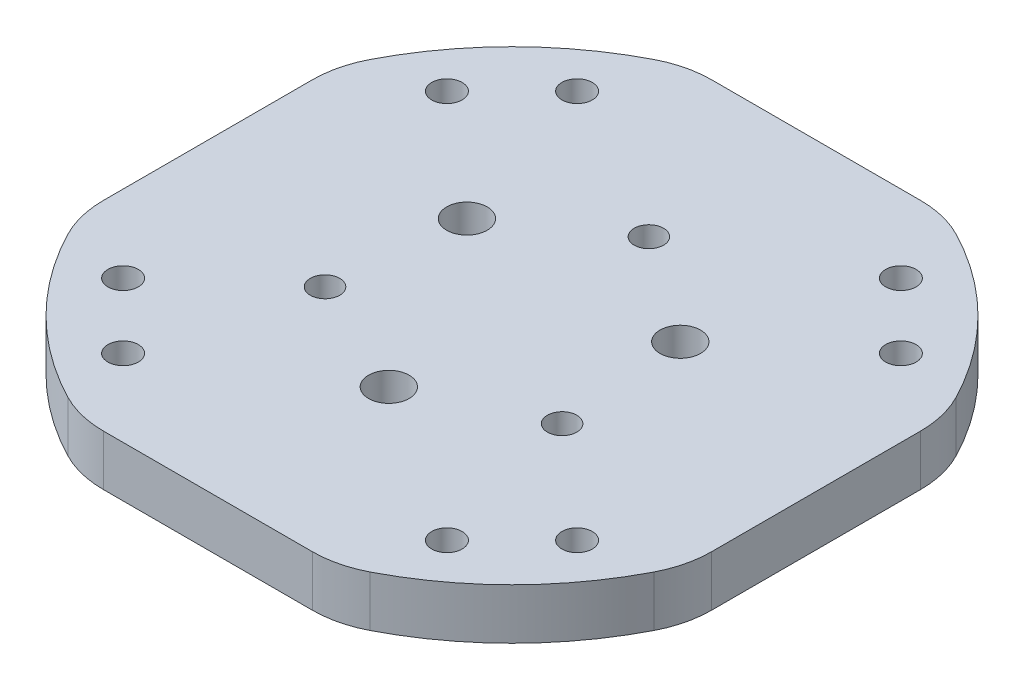
from build123d import *

# Parameters (mm, degrees)
SKETCH_1_R          = 19
SKETCH_1_R_2        = 1.45
SKETCH_1_R_3        = 2
EXTRUDE_1_DEPTH     = 12
EXTRUDE_START       = -7
SKETCH_2_R          = 1.45
SKETCH_2_R_2        = 2
EXTRUDE_2_DEPTH     = 7
SKETCH_3_R          = 1.45
CUT_EXTRUDE_1_DEPTH = 8
SKETCH_4_R          = 1.45
CUT_EXTRUDE_2_DEPTH = 8
SKETCH_5_R          = 1.45
CUT_EXTRUDE_3_DEPTH = 8
CUT_EXTRUDE_START   = -8
SKETCH_6_R          = 1.45
CUT_EXTRUDE_4_DEPTH = 8
SKETCH_7_R          = 1.45
CUT_EXTRUDE_5_DEPTH = 8
EXTRUDE_START_2     = -5
SKETCH_8_R          = 1.5
SKETCH_8_R_2        = 2
EXTRUDE_3_DEPTH     = 5
FILLET_1_R          = 3
CHAMFER_1_SIZE      = 1.55


with BuildPart() as part:
    # 草图1 → 凸台-拉伸1 (new body)
    with BuildSketch(Plane(origin=(0, 0, 0), x_dir=(1, 0, 0), z_dir=(0, 1, 0))):
        with Locations(Location((0, 0, 0), (0, 0, 270))):
            Circle(SKETCH_1_R)
        with Locations(Location((0, 13.5, 0), (0, 0, 270))):
            Circle(SKETCH_1_R_2, mode=Mode.SUBTRACT)
        with Locations(Location((-11.691342951, -6.75, 0), (0, 0, 270))):
            Circle(SKETCH_1_R_2, mode=Mode.SUBTRACT)
        with Locations(Location((11.691342951, -6.75, 0), (0, 0, 270))):
            Circle(SKETCH_1_R_2, mode=Mode.SUBTRACT)
        with Locations(Location((-10.522208656, 6.075, 0), (0, 0, 270))):
            Circle(SKETCH_1_R_3, mode=Mode.SUBTRACT)
        with Locations(Location((0, -12.15, 0), (0, 0, 270))):
            Circle(SKETCH_1_R_3, mode=Mode.SUBTRACT)
        with Locations(Location((10.522208656, 6.075, 0), (0, 0, 270))):
            Circle(SKETCH_1_R_3, mode=Mode.SUBTRACT)
    extrude(amount=EXTRUDE_1_DEPTH)

    # 草图2 → 凸台-拉伸2 (add)
    with BuildSketch(Plane(origin=(0, 12, 0), x_dir=(1, 0, 0), z_dir=(0, 1, 0)).offset(EXTRUDE_START)):
        Polygon((0, 21.939310229), (-19, 10.969655115), (-19, -10.969655115), (0, -21.939310229), (19, -10.969655115), (19, 10.969655115), align=None)
        with Locations(Location((0, 13.5, 0), (0, 0, 270))):
            Circle(SKETCH_2_R, mode=Mode.SUBTRACT)
        with Locations(Location((-10.522208656, 6.075, 0), (0, 0, 270))):
            Circle(SKETCH_2_R_2, mode=Mode.SUBTRACT)
        with Locations(Location((10.522208656, 6.075, 0), (0, 0, 270))):
            Circle(SKETCH_2_R_2, mode=Mode.SUBTRACT)
        with Locations(Location((-11.691342951, -6.75, 0), (0, 0, 270))):
            Circle(SKETCH_2_R, mode=Mode.SUBTRACT)
        with Locations(Location((0, -12.15, 0), (0, 0, 270))):
            Circle(SKETCH_2_R_2, mode=Mode.SUBTRACT)
        with Locations(Location((11.691342951, -6.75, 0), (0, 0, 270))):
            Circle(SKETCH_2_R, mode=Mode.SUBTRACT)
    extrude(amount=EXTRUDE_2_DEPTH)

    # 草图3 → 切除-拉伸1 (cut)
    with BuildSketch(Plane(origin=(9.5, 0, 16.454482672), x_dir=(0.8660254037844384, 0, -0.5000000000000004), z_dir=(0.5000000000000004, 0, 0.8660254037844384))):
        with Locations((0, 8.5)):
            Circle(SKETCH_3_R)
    extrude(amount=-CUT_EXTRUDE_1_DEPTH, mode=Mode.SUBTRACT)

    # 草图4 → 切除-拉伸2 (cut)
    with BuildSketch(Plane(origin=(-9.5, 0, 16.454482672), x_dir=(0.8660254037844385, 0, 0.5000000000000004), z_dir=(-0.5000000000000003, 0, 0.8660254037844384))):
        with Locations((0, 8.5)):
            Circle(SKETCH_4_R)
    extrude(amount=-CUT_EXTRUDE_2_DEPTH, mode=Mode.SUBTRACT)

    # 草图5 → 切除-拉伸3 (cut)
    with BuildSketch(Plane.ZY.offset(19)):
        with Locations((0, 8.5)):
            Circle(SKETCH_5_R)
    extrude(amount=-CUT_EXTRUDE_3_DEPTH, mode=Mode.SUBTRACT)

    # 草图6 → 切除-拉伸4 (cut)
    with BuildSketch(Plane(origin=(19, 0, 0), x_dir=(0, 0, -1), z_dir=(1, 0, 0)).offset(CUT_EXTRUDE_START)):
        with Locations(Location((0, 8.5, 0), (0, 0, 180))):
            Circle(SKETCH_6_R)
    extrude(amount=CUT_EXTRUDE_4_DEPTH, mode=Mode.SUBTRACT)

    # 草图7 → 切除-拉伸5 (cut)
    with BuildSketch(Plane(origin=(9.5, 0, -16.454482672), x_dir=(-0.8660254037844387, 0, -0.49999999999999994), z_dir=(0.4999999999999999, 0, -0.8660254037844386)).offset(CUT_EXTRUDE_START)):
        with Locations(Location((0, 8.5, 0), (0, 0, 180))):
            Circle(SKETCH_7_R)
    extrude(amount=CUT_EXTRUDE_5_DEPTH, mode=Mode.SUBTRACT)

    # 草图8 → 凸台-拉伸3 (add)
    with BuildSketch(Plane(origin=(0, 12, 0), x_dir=(1, 0, 0), z_dir=(0, 1, 0)).offset(EXTRUDE_START_2)):
        with BuildLine():
            Line((10.307764064, 30), (-10.307764064, 30))
            ThreePointArc((-10.307764064, 30), (-12.664786668, 29.718253158), (-14.888992537, 28.888888889))
            ThreePointArc((-14.888992537, 28.888888889), (-22.980970389, 22.980970389), (-28.888888889, 14.888992537))
            ThreePointArc((-28.888888889, 14.888992537), (-29.718253158, 12.664786668), (-30, 10.307764064))
            Line((-30, 10.307764064), (-30, -10.307764064))
            ThreePointArc((-30, -10.307764064), (-29.718253158, -12.664786668), (-28.888888889, -14.888992537))
            ThreePointArc((-28.888888889, -14.888992537), (-22.980970389, -22.980970389), (-14.888992537, -28.888888889))
            ThreePointArc((-14.888992537, -28.888888889), (-12.664786668, -29.718253158), (-10.307764064, -30))
            Line((-10.307764064, -30), (10.307764064, -30))
            ThreePointArc((10.307764064, -30), (12.664786668, -29.718253158), (14.888992537, -28.888888889))
            ThreePointArc((14.888992537, -28.888888889), (22.980970389, -22.980970389), (28.888888889, -14.888992537))
            ThreePointArc((28.888888889, -14.888992537), (29.718253158, -12.664786668), (30, -10.307764064))
            Line((30, -10.307764064), (30, 10.307764064))
            ThreePointArc((30, 10.307764064), (29.718253158, 12.664786668), (28.888888889, 14.888992537))
            ThreePointArc((28.888888889, 14.888992537), (22.980970389, 22.980970389), (14.888992537, 28.888888889))
            ThreePointArc((14.888992537, 28.888888889), (12.664786668, 29.718253158), (10.307764064, 30))
        make_face()
        with Locations(Location((-22.388176755, 15.969331282, 0), (0, 0, 270))):
            Circle(SKETCH_8_R, mode=Mode.SUBTRACT)
        with Locations(Location((-15.969331282, 22.388176755, 0), (0, 0, 270))):
            Circle(SKETCH_8_R, mode=Mode.SUBTRACT)
        with Locations(Location((-22.388176755, -15.969331282, 0), (0, 0, 90))):
            Circle(SKETCH_8_R, mode=Mode.SUBTRACT)
        with Locations(Location((-15.969331282, -22.388176755, 0), (0, 0, 90))):
            Circle(SKETCH_8_R, mode=Mode.SUBTRACT)
        with Locations(Location((15.969331282, -22.388176755, 0), (0, 0, 270))):
            Circle(SKETCH_8_R, mode=Mode.SUBTRACT)
        with Locations(Location((22.388176755, -15.969331282, 0), (0, 0, 270))):
            Circle(SKETCH_8_R, mode=Mode.SUBTRACT)
        with Locations(Location((22.388176755, 15.969331282, 0), (0, 0, 90))):
            Circle(SKETCH_8_R, mode=Mode.SUBTRACT)
        with Locations(Location((15.969331282, 22.388176755, 0), (0, 0, 90))):
            Circle(SKETCH_8_R, mode=Mode.SUBTRACT)
        with Locations((0, 13.5)):
            Circle(SKETCH_8_R, mode=Mode.SUBTRACT)
        with Locations((11.691342951, -6.75)):
            Circle(SKETCH_8_R, mode=Mode.SUBTRACT)
        with Locations(Location((0, -12.15, 0), (0, 0, 270))):
            Circle(SKETCH_8_R_2, mode=Mode.SUBTRACT)
        with Locations(Location((10.522208656, 6.075, 0), (0, 0, 270))):
            Circle(SKETCH_8_R_2, mode=Mode.SUBTRACT)
        with Locations((-11.691342951, -6.75)):
            Circle(SKETCH_8_R, mode=Mode.SUBTRACT)
        with Locations(Location((-10.522208656, 6.075, 0), (0, 0, 270))):
            Circle(SKETCH_8_R_2, mode=Mode.SUBTRACT)
    extrude(amount=EXTRUDE_3_DEPTH)

    # 圆角1
    # the kernel refuses this fillet: 3 mm, written as the material it adds along each edge
    with BuildSketch(Plane(origin=(-25.123724357, 7, 7.434121209), x_dir=(0, -1, 0), z_dir=(0.8660254037844385, 0, 0.5000000000000003))) as fillet_1_piece_1_section:
        with BuildLine():
            CenterArc((3, -2.828427125), FILLET_1_R, 109.471220634, 70.528779366)
            Line((0, -2.828427125), (-0.06, -2.828427125))
            Line((-0.06, -2.828427125), (-0.06, 0))
            Line((-0.06, 0), (0, 0.06))
            ThreePointArc((0, 0.06), (1, 0.06), (1.98, 0.056568542))
            Line((1.98, 0.056568542), (2, 0))
        make_face()
    fillet_1_piece_1 = extrude(amount=36.081445853, mode=Mode.PRIVATE)
    fillet_1_piece_1 = split(fillet_1_piece_1, bisect_by=Plane(origin=(-5.242974287, 6.477045854, 24.966342845), z_dir=(-0.5000000000000004, 0, -0.8660254037844384)), keep=Keep.TOP, mode=Mode.PRIVATE)
    fillet_1_piece_1 = split(fillet_1_piece_1, bisect_by=Plane(origin=(-19, 6.477045854, 17.023720346), z_dir=(1, 0, 0)), keep=Keep.TOP, mode=Mode.PRIVATE)
    add(fillet_1_piece_1)
    with BuildSketch(Plane(origin=(-6.123724357, 7, 25.474844135), x_dir=(0, -1, 0), z_dir=(0.8660254037844384, 0, -0.5000000000000004))) as fillet_1_piece_2_section:
        with BuildLine():
            CenterArc((3, -2.828427125), FILLET_1_R, 109.471220634, 70.528779366)
            Line((0, -2.828427125), (-0.06, -2.828427125))
            Line((-0.06, -2.828427125), (-0.06, 0))
            Line((-0.06, 0), (0, 0.06))
            ThreePointArc((0, 0.06), (1, 0.06), (1.98, 0.056568542))
            Line((1.98, 0.056568542), (2, 0))
        make_face()
    fillet_1_piece_2 = extrude(amount=36.081445853, mode=Mode.PRIVATE)
    fillet_1_piece_2 = split(fillet_1_piece_2, bisect_by=Plane(origin=(19, 6.477045854, 17.023720346), z_dir=(-1, 0, 0)), keep=Keep.TOP, mode=Mode.PRIVATE)
    fillet_1_piece_2 = split(fillet_1_piece_2, bisect_by=Plane(origin=(5.242974287, 6.477045854, 24.966342845), z_dir=(0.5000000000000003, 0, -0.8660254037844385)), keep=Keep.TOP, mode=Mode.PRIVATE)
    add(fillet_1_piece_2)
    with BuildSketch(Plane(origin=(19, 7, 18.040722926), x_dir=(1, 0, 0), z_dir=(0, 0, -1))) as fillet_1_piece_3_section:
        with BuildLine():
            CenterArc((2.828427125, 3), FILLET_1_R, 199.471220634, 70.528779366)
            Line((0, 2), (-0.056568542, 1.98))
            ThreePointArc((-0.056568542, 1.98), (-0.06, 1), (-0.06, 0))
            Line((-0.06, 0), (0, -0.06))
            Line((0, -0.06), (2.828427125, -0.06))
            Line((2.828427125, -0.06), (2.828427125, 0))
        make_face()
    fillet_1_piece_3 = extrude(amount=36.081445853, mode=Mode.PRIVATE)
    fillet_1_piece_3 = split(fillet_1_piece_3, bisect_by=Plane(origin=(24.242974287, 6.477045854, 7.942622499), z_dir=(-0.5000000000000004, 0, -0.8660254037844384)), keep=Keep.TOP, mode=Mode.PRIVATE)
    fillet_1_piece_3 = split(fillet_1_piece_3, bisect_by=Plane(origin=(24.242974287, 6.477045854, -7.942622499), z_dir=(-0.49999999999999983, 0, 0.8660254037844388)), keep=Keep.TOP, mode=Mode.PRIVATE)
    add(fillet_1_piece_3)
    with BuildSketch(Plane(origin=(25.123724357, 7, -7.434121209), x_dir=(0, -1, 0), z_dir=(-0.8660254037844388, 0, -0.49999999999999983))) as fillet_1_piece_4_section:
        with BuildLine():
            CenterArc((3, -2.828427125), FILLET_1_R, 109.471220634, 70.528779366)
            Line((0, -2.828427125), (-0.06, -2.828427125))
            Line((-0.06, -2.828427125), (-0.06, 0))
            Line((-0.06, 0), (0, 0.06))
            ThreePointArc((0, 0.06), (1, 0.06), (1.98, 0.056568542))
            Line((1.98, 0.056568542), (2, 0))
        make_face()
    fillet_1_piece_4 = extrude(amount=36.081445853, mode=Mode.PRIVATE)
    fillet_1_piece_4 = split(fillet_1_piece_4, bisect_by=Plane(origin=(5.242974287, 6.477045854, -24.966342845), z_dir=(0.5000000000000001, 0, 0.8660254037844386)), keep=Keep.TOP, mode=Mode.PRIVATE)
    fillet_1_piece_4 = split(fillet_1_piece_4, bisect_by=Plane(origin=(19, 6.477045854, -17.023720346), z_dir=(-1, 0, 0)), keep=Keep.TOP, mode=Mode.PRIVATE)
    add(fillet_1_piece_4)
    with BuildSketch(Plane(origin=(6.123724357, 7, -25.474844135), x_dir=(0, -1, 0), z_dir=(-0.8660254037844386, 0, 0.5000000000000001))) as fillet_1_piece_5_section:
        with BuildLine():
            CenterArc((3, -2.828427125), FILLET_1_R, 109.471220634, 70.528779366)
            Line((0, -2.828427125), (-0.06, -2.828427125))
            Line((-0.06, -2.828427125), (-0.06, 0))
            Line((-0.06, 0), (0, 0.06))
            ThreePointArc((0, 0.06), (1, 0.06), (1.98, 0.056568542))
            Line((1.98, 0.056568542), (2, 0))
        make_face()
    fillet_1_piece_5 = extrude(amount=36.081445853, mode=Mode.PRIVATE)
    fillet_1_piece_5 = split(fillet_1_piece_5, bisect_by=Plane(origin=(-19, 6.477045854, -17.023720346), z_dir=(1, 0, 0)), keep=Keep.TOP, mode=Mode.PRIVATE)
    fillet_1_piece_5 = split(fillet_1_piece_5, bisect_by=Plane(origin=(-5.242974287, 6.477045854, -24.966342845), z_dir=(-0.49999999999999983, 0, 0.8660254037844388)), keep=Keep.TOP, mode=Mode.PRIVATE)
    add(fillet_1_piece_5)
    with BuildSketch(Plane(origin=(-19, 7, -18.040722926), x_dir=(0, -1, 0), z_dir=(0, 0, 1))) as fillet_1_piece_6_section:
        with BuildLine():
            CenterArc((3, -2.828427125), FILLET_1_R, 109.471220634, 70.528779366)
            Line((0, -2.828427125), (-0.06, -2.828427125))
            Line((-0.06, -2.828427125), (-0.06, 0))
            Line((-0.06, 0), (0, 0.06))
            ThreePointArc((0, 0.06), (1, 0.06), (1.98, 0.056568542))
            Line((1.98, 0.056568542), (2, 0))
        make_face()
    fillet_1_piece_6 = extrude(amount=36.081445853, mode=Mode.PRIVATE)
    fillet_1_piece_6 = split(fillet_1_piece_6, bisect_by=Plane(origin=(-24.242974287, 6.477045854, 7.942622499), z_dir=(0.5000000000000003, 0, -0.8660254037844385)), keep=Keep.TOP, mode=Mode.PRIVATE)
    fillet_1_piece_6 = split(fillet_1_piece_6, bisect_by=Plane(origin=(-24.242974287, 6.477045854, -7.942622499), z_dir=(0.5000000000000001, 0, 0.8660254037844386)), keep=Keep.TOP, mode=Mode.PRIVATE)
    add(fillet_1_piece_6)
    with BuildSketch(Plane(origin=(-25.123724357, 7, 7.434121209), x_dir=(0, -1, 0), z_dir=(0.8660254037844385, 0, 0.5000000000000003))) as fillet_1_piece_7a_section:
        with BuildLine():
            CenterArc((3, -2.828427125), FILLET_1_R, 109.471220634, 70.528779366)
            Line((0, -2.828427125), (-0.06, -2.828427125))
            Line((-0.06, -2.828427125), (-0.06, 0))
            Line((-0.06, 0), (0, 0.06))
            ThreePointArc((0, 0.06), (1, 0.06), (1.98, 0.056568542))
            Line((1.98, 0.056568542), (2, 0))
        make_face()
    fillet_1_piece_7a = extrude(amount=36.081445853, mode=Mode.PRIVATE)
    fillet_1_piece_7a = split(fillet_1_piece_7a, bisect_by=Plane(origin=(-19, 6.499823967, 9.91733875), z_dir=(-1, 0, 0)), keep=Keep.TOP, mode=Mode.PRIVATE)
    with BuildSketch(Plane(origin=(-19, 7, -18.040722926), x_dir=(0, -1, 0), z_dir=(0, 0, 1))) as fillet_1_piece_7b_section:
        with BuildLine():
            CenterArc((3, -2.828427125), FILLET_1_R, 109.471220634, 70.528779366)
            Line((0, -2.828427125), (-0.06, -2.828427125))
            Line((-0.06, -2.828427125), (-0.06, 0))
            Line((-0.06, 0), (0, 0.06))
            ThreePointArc((0, 0.06), (1, 0.06), (1.98, 0.056568542))
            Line((1.98, 0.056568542), (2, 0))
        make_face()
    fillet_1_piece_7b = extrude(amount=36.081445853, mode=Mode.PRIVATE)
    fillet_1_piece_7b = split(fillet_1_piece_7b, bisect_by=Plane(origin=(-18.0817985, 6.492985076, 11.499778998), z_dir=(-0.5000000000000003, 0, 0.8660254037844385)), keep=Keep.TOP, mode=Mode.PRIVATE)
    fillet_1_piece_7b = fillet_1_piece_7b - Plane(origin=(-22.388176755, 6.492985076, 15.969331282), x_dir=(0, 0, -1), z_dir=(0, -1, 0)) * Cylinder(1.5, 84, mode=Mode.PRIVATE)
    fillet_1_piece_7 = fillet_1_piece_7a & fillet_1_piece_7b
    add(fillet_1_piece_7)
    with BuildSketch(Plane(origin=(-6.123724357, 7, 25.474844135), x_dir=(0, -1, 0), z_dir=(0.8660254037844384, 0, -0.5000000000000004))) as fillet_1_piece_8a_section:
        with BuildLine():
            CenterArc((3, -2.828427125), FILLET_1_R, 109.471220634, 70.528779366)
            Line((0, -2.828427125), (-0.06, -2.828427125))
            Line((-0.06, -2.828427125), (-0.06, 0))
            Line((-0.06, 0), (0, 0.06))
            ThreePointArc((0, 0.06), (1, 0.06), (1.98, 0.056568542))
            Line((1.98, 0.056568542), (2, 0))
        make_face()
    fillet_1_piece_8a = extrude(amount=36.081445853, mode=Mode.PRIVATE)
    fillet_1_piece_8a = split(fillet_1_piece_8a, bisect_by=Plane(origin=(-0.911332705, 6.499823967, 21.413152047), z_dir=(-0.5000000000000003, 0, 0.8660254037844385)), keep=Keep.TOP, mode=Mode.PRIVATE)
    with BuildSketch(Plane(origin=(-25.123724357, 7, 7.434121209), x_dir=(0, -1, 0), z_dir=(0.8660254037844385, 0, 0.5000000000000003))) as fillet_1_piece_8b_section:
        with BuildLine():
            CenterArc((3, -2.828427125), FILLET_1_R, 109.471220634, 70.528779366)
            Line((0, -2.828427125), (-0.06, -2.828427125))
            Line((-0.06, -2.828427125), (-0.06, 0))
            Line((-0.06, 0), (0, 0.06))
            ThreePointArc((0, 0.06), (1, 0.06), (1.98, 0.056568542))
            Line((1.98, 0.056568542), (2, 0))
        make_face()
    fillet_1_piece_8b = extrude(amount=36.081445853, mode=Mode.PRIVATE)
    fillet_1_piece_8b = split(fillet_1_piece_8b, bisect_by=Plane(origin=(0.911332705, 6.499823967, 21.413152047), z_dir=(0.5000000000000004, 0, 0.8660254037844384)), keep=Keep.TOP, mode=Mode.PRIVATE)
    fillet_1_piece_8 = fillet_1_piece_8a & fillet_1_piece_8b
    add(fillet_1_piece_8)
    with BuildSketch(Plane(origin=(-6.123724357, 7, 25.474844135), x_dir=(0, -1, 0), z_dir=(0.8660254037844384, 0, -0.5000000000000004))) as fillet_1_piece_9a_section:
        with BuildLine():
            CenterArc((3, -2.828427125), FILLET_1_R, 109.471220634, 70.528779366)
            Line((0, -2.828427125), (-0.06, -2.828427125))
            Line((-0.06, -2.828427125), (-0.06, 0))
            Line((-0.06, 0), (0, 0.06))
            ThreePointArc((0, 0.06), (1, 0.06), (1.98, 0.056568542))
            Line((1.98, 0.056568542), (2, 0))
        make_face()
    fillet_1_piece_9a = extrude(amount=36.081445853, mode=Mode.PRIVATE)
    fillet_1_piece_9a = split(fillet_1_piece_9a, bisect_by=Plane(origin=(19, 6.499823967, 9.91733875), z_dir=(1, 0, 0)), keep=Keep.TOP, mode=Mode.PRIVATE)
    with BuildSketch(Plane(origin=(19, 7, 18.040722926), x_dir=(1, 0, 0), z_dir=(0, 0, -1))) as fillet_1_piece_9b_section:
        with BuildLine():
            CenterArc((2.828427125, 3), FILLET_1_R, 199.471220634, 70.528779366)
            Line((0, 2), (-0.056568542, 1.98))
            ThreePointArc((-0.056568542, 1.98), (-0.06, 1), (-0.06, 0))
            Line((-0.06, 0), (0, -0.06))
            Line((0, -0.06), (2.828427125, -0.06))
            Line((2.828427125, -0.06), (2.828427125, 0))
        make_face()
    fillet_1_piece_9b = extrude(amount=36.081445853, mode=Mode.PRIVATE)
    fillet_1_piece_9b = split(fillet_1_piece_9b, bisect_by=Plane(origin=(18.081798409, 6.49298497, 11.49977905), z_dir=(0.5000000000000004, 0, 0.8660254037844384)), keep=Keep.TOP, mode=Mode.PRIVATE)
    fillet_1_piece_9b = fillet_1_piece_9b - Plane(origin=(22.388176755, 6.49298497, 15.969331282), x_dir=(0, 0, 1), z_dir=(0, -1, 0)) * Cylinder(1.5, 84, mode=Mode.PRIVATE)
    fillet_1_piece_9 = fillet_1_piece_9a & fillet_1_piece_9b
    add(fillet_1_piece_9)
    with BuildSketch(Plane(origin=(25.123724357, 7, -7.434121209), x_dir=(0, -1, 0), z_dir=(-0.8660254037844388, 0, -0.49999999999999983))) as fillet_1_piece_10a_section:
        with BuildLine():
            CenterArc((3, -2.828427125), FILLET_1_R, 109.471220634, 70.528779366)
            Line((0, -2.828427125), (-0.06, -2.828427125))
            Line((-0.06, -2.828427125), (-0.06, 0))
            Line((-0.06, 0), (0, 0.06))
            ThreePointArc((0, 0.06), (1, 0.06), (1.98, 0.056568542))
            Line((1.98, 0.056568542), (2, 0))
        make_face()
    fillet_1_piece_10a = extrude(amount=36.081445853, mode=Mode.PRIVATE)
    fillet_1_piece_10a = split(fillet_1_piece_10a, bisect_by=Plane(origin=(19, 6.499823967, -9.91733875), z_dir=(1, 0, 0)), keep=Keep.TOP, mode=Mode.PRIVATE)
    with BuildSketch(Plane(origin=(19, 7, 18.040722926), x_dir=(1, 0, 0), z_dir=(0, 0, -1))) as fillet_1_piece_10b_section:
        with BuildLine():
            CenterArc((2.828427125, 3), FILLET_1_R, 199.471220634, 70.528779366)
            Line((0, 2), (-0.056568542, 1.98))
            ThreePointArc((-0.056568542, 1.98), (-0.06, 1), (-0.06, 0))
            Line((-0.06, 0), (0, -0.06))
            Line((0, -0.06), (2.828427125, -0.06))
            Line((2.828427125, -0.06), (2.828427125, 0))
        make_face()
    fillet_1_piece_10b = extrude(amount=36.081445853, mode=Mode.PRIVATE)
    fillet_1_piece_10b = split(fillet_1_piece_10b, bisect_by=Plane(origin=(18.081798409, 6.49298497, -11.49977905), z_dir=(0.49999999999999983, 0, -0.8660254037844388)), keep=Keep.TOP, mode=Mode.PRIVATE)
    fillet_1_piece_10b = fillet_1_piece_10b - Plane(origin=(22.388176755, 6.49298497, -15.969331282), x_dir=(0, 0, -1), z_dir=(0, -1, 0)) * Cylinder(1.5, 84, mode=Mode.PRIVATE)
    fillet_1_piece_10 = fillet_1_piece_10a & fillet_1_piece_10b
    add(fillet_1_piece_10)
    with BuildSketch(Plane(origin=(6.123724357, 7, -25.474844135), x_dir=(0, -1, 0), z_dir=(-0.8660254037844386, 0, 0.5000000000000001))) as fillet_1_piece_11a_section:
        with BuildLine():
            CenterArc((3, -2.828427125), FILLET_1_R, 109.471220634, 70.528779366)
            Line((0, -2.828427125), (-0.06, -2.828427125))
            Line((-0.06, -2.828427125), (-0.06, 0))
            Line((-0.06, 0), (0, 0.06))
            ThreePointArc((0, 0.06), (1, 0.06), (1.98, 0.056568542))
            Line((1.98, 0.056568542), (2, 0))
        make_face()
    fillet_1_piece_11a = extrude(amount=36.081445853, mode=Mode.PRIVATE)
    fillet_1_piece_11a = split(fillet_1_piece_11a, bisect_by=Plane(origin=(0.911332705, 6.499823967, -21.413152047), z_dir=(0.49999999999999983, 0, -0.8660254037844388)), keep=Keep.TOP, mode=Mode.PRIVATE)
    with BuildSketch(Plane(origin=(25.123724357, 7, -7.434121209), x_dir=(0, -1, 0), z_dir=(-0.8660254037844388, 0, -0.49999999999999983))) as fillet_1_piece_11b_section:
        with BuildLine():
            CenterArc((3, -2.828427125), FILLET_1_R, 109.471220634, 70.528779366)
            Line((0, -2.828427125), (-0.06, -2.828427125))
            Line((-0.06, -2.828427125), (-0.06, 0))
            Line((-0.06, 0), (0, 0.06))
            ThreePointArc((0, 0.06), (1, 0.06), (1.98, 0.056568542))
            Line((1.98, 0.056568542), (2, 0))
        make_face()
    fillet_1_piece_11b = extrude(amount=36.081445853, mode=Mode.PRIVATE)
    fillet_1_piece_11b = split(fillet_1_piece_11b, bisect_by=Plane(origin=(-0.911332705, 6.499823967, -21.413152047), z_dir=(-0.5000000000000001, 0, -0.8660254037844386)), keep=Keep.TOP, mode=Mode.PRIVATE)
    fillet_1_piece_11 = fillet_1_piece_11a & fillet_1_piece_11b
    add(fillet_1_piece_11)
    with BuildSketch(Plane(origin=(-19, 7, -18.040722926), x_dir=(0, -1, 0), z_dir=(0, 0, 1))) as fillet_1_piece_12a_section:
        with BuildLine():
            CenterArc((3, -2.828427125), FILLET_1_R, 109.471220634, 70.528779366)
            Line((0, -2.828427125), (-0.06, -2.828427125))
            Line((-0.06, -2.828427125), (-0.06, 0))
            Line((-0.06, 0), (0, 0.06))
            ThreePointArc((0, 0.06), (1, 0.06), (1.98, 0.056568542))
            Line((1.98, 0.056568542), (2, 0))
        make_face()
    fillet_1_piece_12a = extrude(amount=36.081445853, mode=Mode.PRIVATE)
    fillet_1_piece_12a = split(fillet_1_piece_12a, bisect_by=Plane(origin=(-18.081798502, 6.492985076, -11.499778997), z_dir=(-0.5000000000000001, 0, -0.8660254037844386)), keep=Keep.TOP, mode=Mode.PRIVATE)
    fillet_1_piece_12a = fillet_1_piece_12a - Plane(origin=(-22.388176755, 6.492985076, -15.969331282), x_dir=(0, 0, 1), z_dir=(0, -1, 0)) * Cylinder(1.5, 84, mode=Mode.PRIVATE)
    with BuildSketch(Plane(origin=(6.123724357, 7, -25.474844135), x_dir=(0, -1, 0), z_dir=(-0.8660254037844386, 0, 0.5000000000000001))) as fillet_1_piece_12b_section:
        with BuildLine():
            CenterArc((3, -2.828427125), FILLET_1_R, 109.471220634, 70.528779366)
            Line((0, -2.828427125), (-0.06, -2.828427125))
            Line((-0.06, -2.828427125), (-0.06, 0))
            Line((-0.06, 0), (0, 0.06))
            ThreePointArc((0, 0.06), (1, 0.06), (1.98, 0.056568542))
            Line((1.98, 0.056568542), (2, 0))
        make_face()
    fillet_1_piece_12b = extrude(amount=36.081445853, mode=Mode.PRIVATE)
    fillet_1_piece_12b = split(fillet_1_piece_12b, bisect_by=Plane(origin=(-19, 6.499823967, -9.91733875), z_dir=(-1, 0, 0)), keep=Keep.TOP, mode=Mode.PRIVATE)
    fillet_1_piece_12 = fillet_1_piece_12a & fillet_1_piece_12b
    add(fillet_1_piece_12)

    # 倒角1
    chamfer_1_edges = [part.edges().sort_by_distance(p)[0] for p in [
        (15.969331282, 7, -20.888176755),
        (22.388176755, 7, -14.469331282),
        (22.388176755, 7, 14.469331282),
        (15.969331282, 7, 20.888176755),
        (-15.969331282, 7, 23.888176755),
        (-22.388176755, 7, 17.469331282),
        (-15.969331282, 7, -23.888176755),
        (-22.388176755, 7, -17.469331282),
    ]]
    chamfer(chamfer_1_edges, length=CHAMFER_1_SIZE)


solid = part.part
